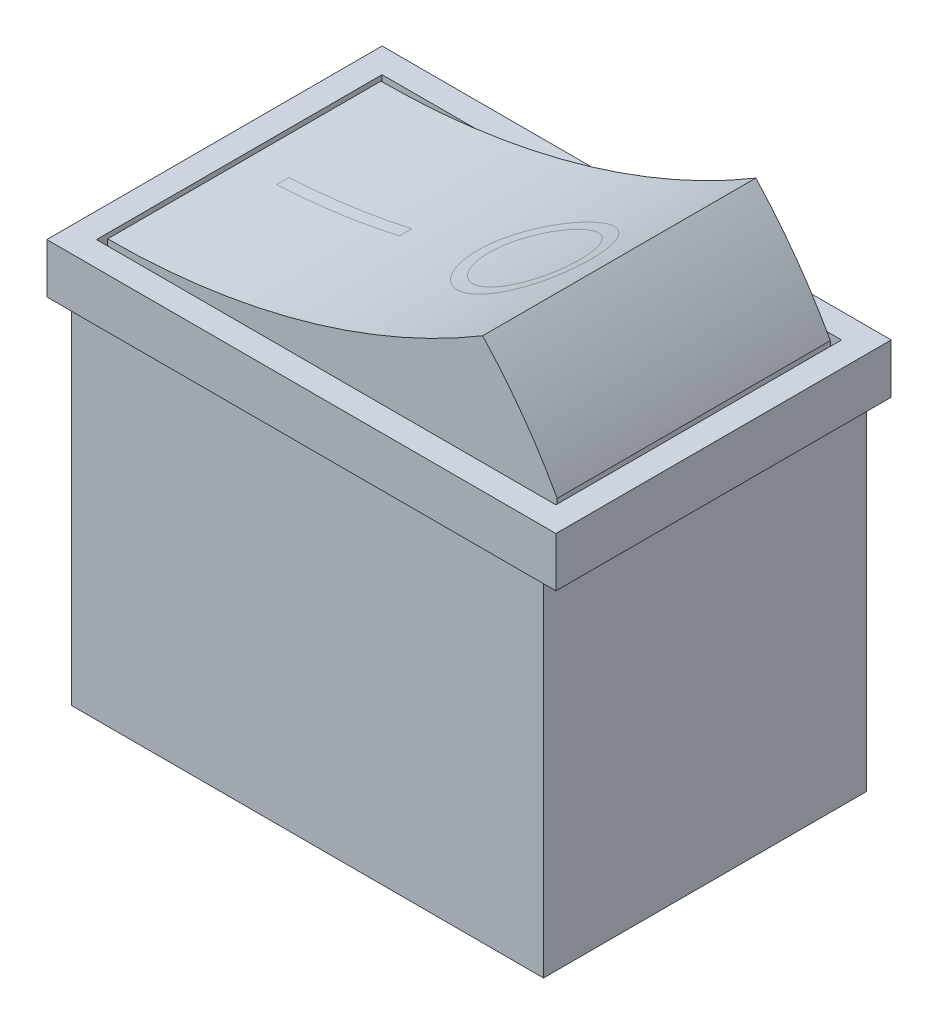
from build123d import *

# Parameters (mm, degrees)
SKETCH1_W           = 19
SKETCH1_H           = 13
BOSS_EXTRUDE1_DEPTH = 14
SKETCH2_W           = 20.5
SKETCH2_H           = 13.5
BOSS_EXTRUDE2_DEPTH = 2
SKETCH3_W           = 18.5
SKETCH3_H           = 11.5
CUT_EXTRUDE1_DEPTH  = 10
BOSS_EXTRUDE3_DEPTH = 5.5


with BuildPart() as part:
    # Sketch1 → Boss-Extrude1 (new body)
    with BuildSketch(Plane(origin=(0, 0, 0), x_dir=(1, 0, 0), z_dir=(0, 1, 0))):
        Rectangle(SKETCH1_W, SKETCH1_H)
    extrude(amount=BOSS_EXTRUDE1_DEPTH)

    # Sketch2 → Boss-Extrude2 (add)
    with BuildSketch(Plane(origin=(0, 14, 0), x_dir=(1, 0, 0), z_dir=(0, 1, 0))):
        Rectangle(SKETCH2_W, SKETCH2_H)
    extrude(amount=BOSS_EXTRUDE2_DEPTH)

    # Sketch3 → Cut-Extrude1 (cut)
    with BuildSketch(Plane(origin=(0, 16, 0), x_dir=(1, 0, 0), z_dir=(0, 1, 0))):
        Rectangle(SKETCH3_W, SKETCH3_H)
    extrude(amount=-CUT_EXTRUDE1_DEPTH, mode=Mode.SUBTRACT)

    # Sketch5 → Boss-Extrude3 (add, symmetric)
    with BuildSketch(Plane.XY):
        with BuildLine():
            Line((9.05, 16), (9.05, 6))
            Line((9.05, 6), (-9.05, 6))
            Line((-9.05, 6), (-9.05, 16))
            ThreePointArc((-9.05, 16), (-1.217341341, 17.06175581), (6.05, 20.170391667))
            ThreePointArc((6.05, 20.170391667), (7.678911414, 18.177929148), (9.05, 16))
        make_face()
    extrude(amount=BOSS_EXTRUDE3_DEPTH, both=True)


solid = part.part
